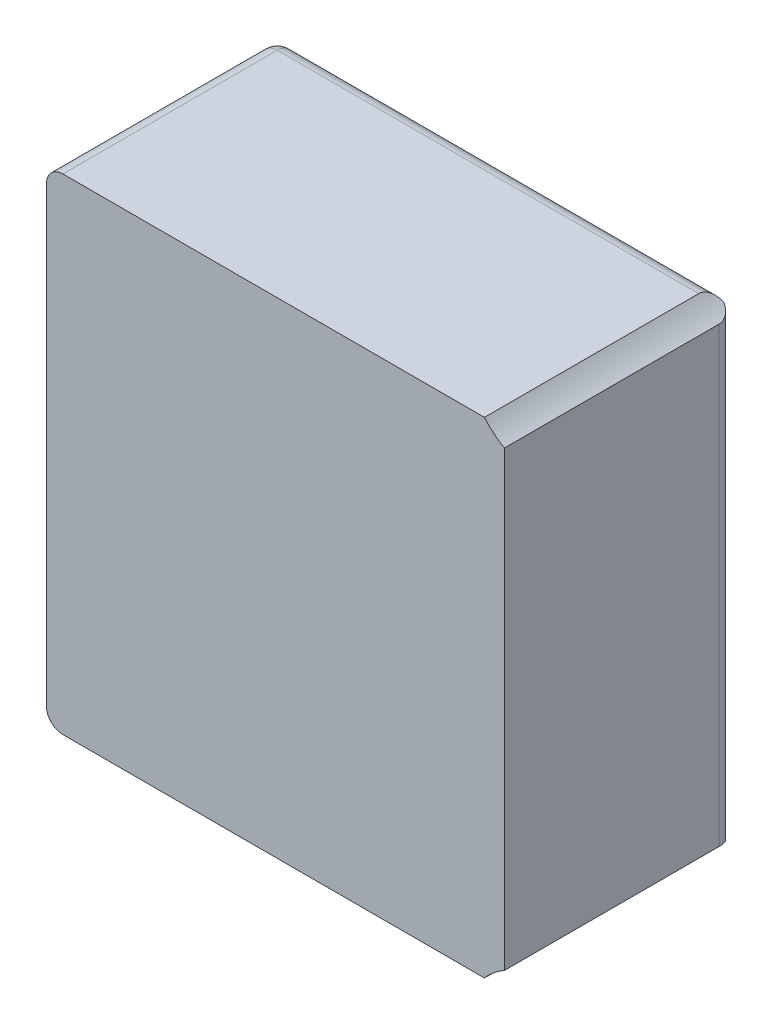
from build123d import *

# Parameters (mm, degrees)
BOSS_EXTRUDE1_DEPTH = 14
FILLET1_R           = 1
FILLET2_R           = 1


with BuildPart() as part:
    # Sketch1 → Boss-Extrude1 (new body)
    with BuildSketch(Plane.XY):
        with BuildLine():
            Line((71.040481499, 34.904877363), (71.040481499, 5.453644912))
            Line((71.040481499, 5.453644912), (97.610515081, 5.453644912))
            add(Edge.make_bspline(
                [(97.610515081, 5.453644912), (97.957362424, 5.858397077), (98.354905943, 6.201823205), (98.824935041, 6.457565141)],
                knots=[0, 0, 0, 0, 1, 1, 1, 1], degree=3))
            Line((98.824935041, 6.457565141), (98.824935041, 33.900957115))
            add(Edge.make_bspline(
                [(98.824935041, 33.900957115), (98.354905942, 34.156699053), (97.957362434, 34.5001252), (97.610515091, 34.904877363)],
                knots=[0, 0, 0, 0, 1, 1, 1, 1], degree=3))
            Line((97.610515091, 34.904877363), (71.040481499, 34.904877363))
        make_face()
    extrude(amount=BOSS_EXTRUDE1_DEPTH)

    # Fillet1
    # the kernel refuses this fillet: 1 mm, written as the material it takes off along each edge
    with BuildSketch(Plane(origin=(98.824935041, 3.957565141, 0), x_dir=(0, 0, 1), z_dir=(0, 1, 0))) as fillet1_piece_1:
        with BuildLine():
            CenterArc((FILLET1_R, -FILLET1_R), FILLET1_R, 90, 90)
            Line((0, -FILLET1_R), (0, 0))
            Line((0, 0), (FILLET1_R, 0))
        make_face()
    extrude(amount=32.443391974, mode=Mode.SUBTRACT)
    with BuildSketch(Plane(origin=(68.540481499, 5.453644912, 0), x_dir=(0, 0, 1), z_dir=(1, 0, 0))) as fillet1_piece_2:
        with BuildLine():
            CenterArc((FILLET1_R, -FILLET1_R), FILLET1_R, 90, 90)
            Line((0, -FILLET1_R), (0, 0))
            Line((0, 0), (FILLET1_R, 0))
        make_face()
    extrude(amount=31.570033582, mode=Mode.SUBTRACT)
    with BuildSketch(Plane(origin=(71.040481499, 37.404877363, 0), x_dir=(0, 0, 1), z_dir=(0, -1, 0))) as fillet1_piece_3:
        with BuildLine():
            CenterArc((FILLET1_R, -FILLET1_R), FILLET1_R, 90, 90)
            Line((0, -FILLET1_R), (0, 0))
            Line((0, 0), (FILLET1_R, 0))
        make_face()
    extrude(amount=34.45123245, mode=Mode.SUBTRACT)
    with BuildSketch(Plane(origin=(100.110515091, 34.904877363, 0), x_dir=(0, 0, 1), z_dir=(-1, 0, 0))) as fillet1_piece_4:
        with BuildLine():
            CenterArc((FILLET1_R, -FILLET1_R), FILLET1_R, 90, 90)
            Line((0, -FILLET1_R), (0, 0))
            Line((0, 0), (FILLET1_R, 0))
        make_face()
    extrude(amount=31.570033592, mode=Mode.SUBTRACT)

    # Fillet2
    # the kernel refuses this fillet: 1 mm, written as the material it takes off along each edge
    with BuildSketch(Plane(origin=(72.040481499, 33.904877363, 1), x_dir=(0, 1, 0), z_dir=(-1, 0, 0))) as fillet2_piece_1_section:
        Polygon((0, 0), (FILLET2_R, 0), (FILLET2_R, FILLET2_R), (0, FILLET2_R), align=None)
    fillet2_piece_1 = extrude(amount=FILLET2_R, mode=Mode.PRIVATE)
    fillet2_piece_1 = fillet2_piece_1 - Plane(origin=(72.040481499, 33.904877363, 1), x_dir=(0, -0.7071067811865475, 0.7071067811865475), z_dir=(-1, 0, 0)) * Sphere(FILLET2_R, mode=Mode.PRIVATE)
    add(fillet2_piece_1, mode=Mode.SUBTRACT)
    with BuildSketch(Plane(origin=(72.040481499, 6.453644912, 1), x_dir=(0, -1, 0), z_dir=(-1, 0, 0))) as fillet2_piece_2_section:
        Polygon((0, 0), (FILLET2_R, 0), (FILLET2_R, -FILLET2_R), (0, -FILLET2_R), align=None)
    fillet2_piece_2 = extrude(amount=FILLET2_R, mode=Mode.PRIVATE)
    fillet2_piece_2 = fillet2_piece_2 - Plane(origin=(72.040481499, 6.453644912, 1), x_dir=(0, 0.7071067811865475, 0.7071067811865475), z_dir=(-1, 0, 0)) * Sphere(FILLET2_R, mode=Mode.PRIVATE)
    add(fillet2_piece_2, mode=Mode.SUBTRACT)
    with BuildSketch(Plane(origin=(71.040481499, 34.904877363, 1), x_dir=(0, -1, 0), z_dir=(0, 0, 1))) as fillet2_piece_3:
        with BuildLine():
            CenterArc((FILLET2_R, FILLET2_R), FILLET2_R, 180, 90)
            Line((0, FILLET2_R), (0, 0))
            Line((0, 0), (FILLET2_R, 0))
        make_face()
    extrude(amount=15.5, mode=Mode.SUBTRACT)
    with BuildSketch(Plane(origin=(71.040481499, 5.453644912, 1), x_dir=(0, 1, 0), z_dir=(0, 0, 1))) as fillet2_piece_4:
        with BuildLine():
            CenterArc((FILLET2_R, -FILLET2_R), FILLET2_R, 90, 90)
            Line((0, -FILLET2_R), (0, 0))
            Line((0, 0), (FILLET2_R, 0))
        make_face()
    extrude(amount=15.5, mode=Mode.SUBTRACT)


solid = part.part
